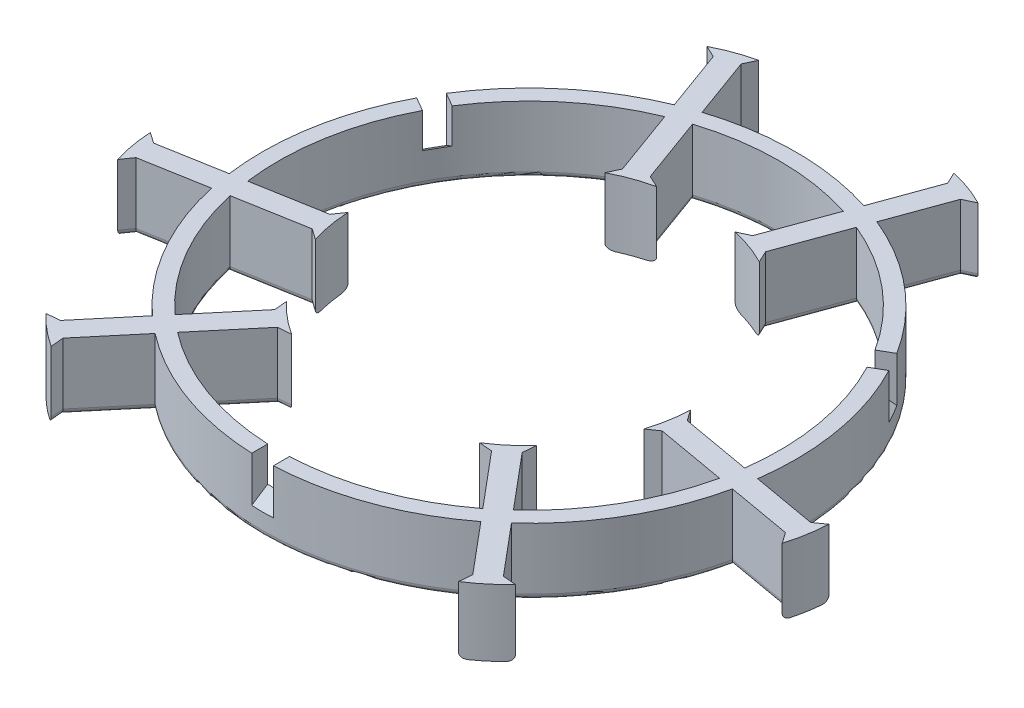
from build123d import *

# Parameters (mm, degrees)
BOSS_EXTRUDE1_DEPTH   = 3.265
BOSS_EXTRUDE1_2_DEPTH = 3.265
BOSS_EXTRUDE1_3_DEPTH = 3.265
BOSS_EXTRUDE2_START   = 3
BOSS_EXTRUDE2_DEPTH   = 3
CUT_EXTRUDE1_START    = -1.02
CUT_EXTRUDE1_DEPTH    = 2.04
CUT_EXTRUDE2_START    = -1.02
CUT_EXTRUDE2_DEPTH    = 2.04
CUT_EXTRUDE3_START    = -1.02
CUT_EXTRUDE3_DEPTH    = 2.04
FILLET1_R             = 0.5


# Read off the part's stored shape, not the designer's step: Cut-Extrude1, Cut-Extrude2, Cut-Extrude3
with BuildPart() as part:
    # Sketch1 → Boss-Extrude1 (new body)
    with BuildSketch(Plane(origin=(0, 0, 0), x_dir=(1, 0, 0), z_dir=(0, 1, 0))):
        with BuildLine():
            Line((-6.724046161570257, 15.491884508116268), (-7.243917375737632, 14.377017091559226))
            ThreePointArc((-7.243917375737632, 14.377017091559226), (-5.5101366147460755, 15.138975927126317), (-3.692205798608258, 15.669734386333252))
            Line((-3.692205798608258, 15.669734386333252), (-4.807073215166055, 16.189605600500883))
            Line((-4.807073215166055, 16.189605600500883), (-7.0816825804111705, 22.43904346959337))
            ThreePointArc((-7.0816825804111705, 22.43904346959337), (-2.991e-14, 23.529999999999998), (7.08168258041111, 22.43904346959339))
            Line((7.08168258041111, 22.43904346959339), (4.807073215165557, 16.189605600501192))
            Line((4.807073215165557, 16.189605600501192), (3.692205798609078, 15.669734386332689))
            ThreePointArc((3.692205798609078, 15.669734386332689), (5.510136614746928, 15.138975927126017), (7.243917375738558, 14.377017091559186))
            Line((7.243917375738558, 14.377017091559186), (6.724046161570118, 15.49188450811891))
            Line((6.724046161570118, 15.49188450811891), (8.998655526814698, 21.74132237720896))
            ThreePointArc((8.998655526814698, 21.74132237720896), (15.124792455922533, 18.02502574659101), (19.848422704126936, 12.637286740368689))
            Line((19.848422704126936, 12.637286740368689), (21.146442856281965, 13.386699024628935))
            ThreePointArc((21.146442856281965, 13.386699024628935), (16.087366901428126, 19.17217730016167), (9.511283720560114, 23.149756764100303))
            Line((9.511283720560114, 23.149756764100303), (11.608093808260845, 28.910695132942674))
            Line((11.608093808260845, 28.910695132942674), (12.722961225975256, 29.43056634765067))
            ThreePointArc((12.722961225975256, 29.43056634765067), (10.988981231010918, 30.191977795013887), (9.171249647149319, 30.723283643037668))
            Line((9.171249647149319, 30.723283643037668), (9.691120861856094, 29.608416225323964))
            Line((9.691120861856094, 29.608416225323964), (7.594310774156528, 23.84747785648474))
            ThreePointArc((7.594310774156528, 23.84747785648474), (-2.07e-14, 25.0275), (-7.594310774156574, 23.847477856484723))
            Line((-7.594310774156574, 23.847477856484723), (-9.691120861856122, 29.608416225323918))
            Line((-9.691120861856122, 29.608416225323918), (-9.171249647149548, 30.723283643037583))
            ThreePointArc((-9.171249647149548, 30.723283643037583), (-10.988981231010609, 30.191977795011873), (-12.72296122597416, 29.430566347646813))
            Line((-12.72296122597416, 29.430566347646813), (-11.608093808260813, 28.910695132939033))
            Line((-11.608093808260813, 28.910695132939033), (-9.511283720561256, 23.14975676409983))
            ThreePointArc((-9.511283720561256, 23.14975676409983), (-16.08736690143116, 19.17217730015912), (-21.14644285628554, 13.386699024623285))
            Line((-21.14644285628554, 13.386699024623285), (-19.848422704130538, 12.63728674036303))
            ThreePointArc((-19.848422704130538, 12.63728674036303), (-15.12479245592557, 18.025025746588454), (-8.998655526815837, 21.741322377208487))
            Line((-8.998655526815837, 21.741322377208487), (-6.724046161570257, 15.491884508116268))
        make_face()
    extrude(amount=BOSS_EXTRUDE1_DEPTH)



with BuildPart() as body_2:
    # Sketch1 → Boss-Extrude1 2 (new body)
    with BuildSketch(Plane(origin=(0, 0, 0), x_dir=(1, 0, 0), z_dir=(0, 1, 0))):
        with BuildLine():
            Line((16.778388617308416, -1.9227474619188947), (16.072820719802163, -0.915092075474559))
            ThreePointArc((16.072820719802163, -0.915092075474559), (15.865806047545636, -2.797569676869933), (15.416490948423451, -4.637323175571752))
            Line((15.416490948423451, -4.637323175571752), (16.424146334867597, -3.931755278064976))
            Line((16.424146334867597, -3.931755278064976), (22.97362297149689, -5.086604718622285))
            ThreePointArc((22.97362297149689, -5.086604718622285), (20.377577751048157, -11.764999999999455), (15.89194039108607, -17.352438750970055))
            Line((15.89194039108607, -17.352438750970055), (11.617073119702077, -12.257850322435555))
            Line((11.617073119702077, -12.257850322435555), (11.724285149814596, -11.032411210761367))
            ThreePointArc((11.724285149814596, -11.032411210761367), (10.355669432799003, -12.341406250256417), (8.82890334406401, -13.461925016084827))
            Line((8.82890334406401, -13.461925016084827), (10.05434245573841, -13.569137046196877))
            Line((10.05434245573841, -13.569137046196877), (14.329209727122183, -18.663725474731653))
            ThreePointArc((14.329209727122183, -18.663725474731653), (8.047733972454916, -22.110967367091718), (1.0200000000042755, -23.507881657010085))
            Line((1.0200000000042755, -23.507881657010085), (1.0200000000042755, -25.0067062255306))
            ThreePointArc((1.0200000000042755, -25.0067062255306), (8.559909137085095, -23.518157066718615), (15.292635588860929, -19.811891706656986))
            Line((15.292635588860929, -19.811891706656986), (19.233349522062255, -24.508251693935826))
            Line((19.233349522062255, -24.508251693935826), (19.12613749183851, -25.733690806881363))
            ThreePointArc((19.12613749183851, -25.733690806881363), (20.652529145470048, -24.612725805270422), (22.021519298969324, -23.304177000397384))
            Line((22.021519298969324, -23.304177000397384), (20.79608018602495, -23.19696497017267))
            Line((20.79608018602495, -23.19696497017267), (16.85536625282483, -18.50060498289538))
            ThreePointArc((16.85536625282483, -18.50060498289538), (21.674450793215346, -12.513749999999444), (24.449677026981057, -5.346872873588295))
            Line((24.449677026981057, -5.346872873588295), (30.487201047881946, -6.411451255148618))
            Line((30.487201047881946, -6.411451255148618), (31.192768946120204, -7.419106642638354))
            ThreePointArc((31.192768946120204, -7.419106642638354), (31.64151037648007, -5.579251989740153), (31.84909871781023, -3.6968755407649807))
            Line((31.84909871781023, -3.6968755407649807), (30.841443330320814, -4.4024434390017975))
            Line((30.841443330320814, -4.4024434390017975), (24.80391930942181, -3.3378650574418454))
            ThreePointArc((24.80391930942181, -3.3378650574418454), (24.647276038512683, 4.345979766561039), (22.166442856282952, 11.6200072009075))
            Line((22.166442856282952, 11.6200072009075), (20.868422704127948, 10.870594916647262))
            ThreePointArc((20.868422704127948, 10.870594916647262), (23.17252642837691, 4.085941620504811), (23.327865253937638, -3.0775969024758494))
            Line((23.327865253937638, -3.0775969024758494), (16.778388617308416, -1.9227474619188947))
        make_face()
    extrude(amount=BOSS_EXTRUDE1_2_DEPTH)


with BuildPart() as body_3:
    # Sketch1 → Boss-Extrude1 3 (new body)
    with BuildSketch(Plane(origin=(0, 0, 0), x_dir=(1, 0, 0), z_dir=(0, 1, 0))):
        with BuildLine():
            Line((-10.054342455737974, -13.569137046197184), (-8.828903344063827, -13.461925016084178))
            ThreePointArc((-8.828903344063827, -13.461925016084178), (-10.355669432799177, -12.341406250256197), (-11.724285149815183, -11.032411210761536))
            Line((-11.724285149815183, -11.032411210761536), (-11.617073119701665, -12.257850322435877))
            Line((-11.617073119701665, -12.257850322435877), (-15.891940391085214, -17.35243875097084))
            ThreePointArc((-15.891940391085214, -17.35243875097084), (-20.37757775104771, -11.765000000000223), (-22.973622971496752, -5.086604718622892))
            Line((-22.973622971496752, -5.086604718622892), (-16.424146334867487, -3.9317552780654426))
            Line((-16.424146334867487, -3.9317552780654426), (-15.416490948422714, -4.63732317557104))
            ThreePointArc((-15.416490948422714, -4.63732317557104), (-15.865806047545515, -2.797569676869464), (-16.072820719802706, -0.915092075474255))
            Line((-16.072820719802706, -0.915092075474255), (-16.77838861730829, -1.92274746191903))
            Line((-16.77838861730829, -1.92274746191903), (-23.327865253937556, -3.077596902476493))
            ThreePointArc((-23.327865253937556, -3.077596902476493), (-23.17252642837756, 4.085941620501193), (-20.86842270413105, 10.870594916641313))
            Line((-20.86842270413105, 10.870594916641313), (-22.16644285628606, 11.620007200901576))
            ThreePointArc((-22.16644285628606, 11.620007200901576), (-24.647276038513326, 4.345979766557433), (-24.803919309421726, -3.3378650574425))
            Line((-24.803919309421726, -3.3378650574425), (-30.841443330322626, -4.402443439002778))
            Line((-30.841443330322626, -4.402443439002778), (-31.84909871781261, -3.696875540765329))
            ThreePointArc((-31.84909871781261, -3.696875540765329), (-31.64151037648127, -5.579251989740306), (-31.192768946120268, -7.419106642638173))
            Line((-31.192768946120268, -7.419106642638173), (-30.48720104788182, -6.411451255149191))
            Line((-30.48720104788182, -6.411451255149191), (-24.449677026980922, -5.346872873588901))
            ThreePointArc((-24.449677026980922, -5.346872873588901), (-21.674450793214902, -12.513750000000215), (-16.855366252823973, -18.500604982896164))
            Line((-16.855366252823973, -18.500604982896164), (-20.796080186025396, -23.196964970174925))
            Line((-20.796080186025396, -23.196964970174925), (-22.021519298970887, -23.30417700039917))
            ThreePointArc((-22.021519298970887, -23.30417700039917), (-20.652529145470872, -24.612725805271324), (-19.126137491838684, -25.73369080688126))
            Line((-19.126137491838684, -25.73369080688126), (-19.233349522061783, -24.508251693936156))
            Line((-19.233349522061783, -24.508251693936156), (-15.29263558886042, -19.811891706657374))
            ThreePointArc((-15.29263558886042, -19.811891706657374), (-8.559909137081489, -23.518157066719926), (-1.0199999999972424, -25.006706225530888))
            Line((-1.0199999999972424, -25.006706225530888), (-1.0199999999972424, -23.50788165701039))
            ThreePointArc((-1.0199999999972424, -23.50788165701039), (-8.047733972451303, -22.110967367093032), (-14.329209727121667, -18.663725474732036))
            Line((-14.329209727121667, -18.663725474732036), (-10.054342455737974, -13.569137046197184))
        make_face()
    extrude(amount=BOSS_EXTRUDE1_3_DEPTH)


with BuildPart() as part_1:
    add(part.part)

    add(body_2.part)  # Boss-Extrude2 merges body 2

    add(body_3.part)  # Boss-Extrude2 merges body 3
    # Sketch2 → Boss-Extrude2 (add)
    with BuildSketch(Plane.XZ.offset(BOSS_EXTRUDE2_START)):
        with BuildLine():
            Line((-9.511283720561254, -23.149756764099834), (-11.608093808260813, -28.910695132939033))
            Line((-11.608093808260813, -28.910695132939033), (-12.72296122597416, -29.430566347646813))
            ThreePointArc((-12.72296122597416, -29.430566347646813), (-10.98898123101061, -30.191977795011873), (-9.171249647149551, -30.723283643037583))
            Line((-9.171249647149551, -30.723283643037583), (-9.691120861856122, -29.608416225323918))
            Line((-9.691120861856122, -29.608416225323918), (-7.594310774156574, -23.847477856484723))
            ThreePointArc((-7.594310774156574, -23.847477856484723), (-2.07e-14, -25.027499999999996), (7.59431077415653, -23.84747785648474))
            Line((7.59431077415653, -23.84747785648474), (9.691120861856094, -29.608416225323964))
            Line((9.691120861856094, -29.608416225323964), (9.171249647149319, -30.723283643037668))
            ThreePointArc((9.171249647149319, -30.723283643037668), (10.988981231010918, -30.191977795013887), (12.722961225975256, -29.43056634765067))
            Line((12.722961225975256, -29.43056634765067), (11.608093808260845, -28.910695132942674))
            Line((11.608093808260845, -28.910695132942674), (9.511283720560114, -23.149756764100303))
            ThreePointArc((9.511283720560114, -23.149756764100303), (16.08736690142813, -19.17217730016167), (21.146442856281965, -13.386699024628932))
            ThreePointArc((21.146442856281965, -13.386699024628932), (21.67445079321339, -12.513750000002842), (22.166442856282952, -11.6200072009075))
            ThreePointArc((22.166442856282952, -11.6200072009075), (24.647276038512686, -4.345979766561041), (24.803919309421815, 3.3378650574418436))
            Line((24.803919309421815, 3.3378650574418436), (30.841443330320814, 4.4024434390017975))
            Line((30.841443330320814, 4.4024434390017975), (31.84909871781023, 3.6968755407649807))
            ThreePointArc((31.84909871781023, 3.6968755407649807), (31.64151037648007, 5.579251989740151), (31.192768946120207, 7.4191066426383525))
            Line((31.192768946120207, 7.4191066426383525), (30.487201047881946, 6.411451255148618))
            Line((30.487201047881946, 6.411451255148618), (24.449677026981057, 5.346872873588295))
            ThreePointArc((24.449677026981057, 5.346872873588295), (21.67445079321535, 12.513749999999446), (16.85536625282483, 18.50060498289538))
            Line((16.85536625282483, 18.50060498289538), (20.79608018602495, 23.19696497017267))
            Line((20.79608018602495, 23.19696497017267), (22.021519298969324, 23.304177000397384))
            ThreePointArc((22.021519298969324, 23.304177000397384), (20.652529145470048, 24.612725805270422), (19.126137491838495, 25.73369080688134))
            Line((19.126137491838495, 25.73369080688134), (19.233349522062255, 24.508251693935826))
            Line((19.233349522062255, 24.508251693935826), (15.292635588860929, 19.811891706656986))
            ThreePointArc((15.292635588860929, 19.811891706656986), (8.559909137085095, 23.518157066718615), (1.0200000000042755, 25.0067062255306))
            ThreePointArc((1.0200000000042755, 25.0067062255306), (3.51925e-12, 25.027499999999993), (-1.0199999999972424, 25.006706225530888))
            ThreePointArc((-1.0199999999972424, 25.006706225530888), (-8.5599091370815, 23.518157066719926), (-15.292635588860433, 19.81189170665737))
            Line((-15.292635588860433, 19.81189170665737), (-19.233349522061783, 24.508251693936156))
            Line((-19.233349522061783, 24.508251693936156), (-19.126137491838684, 25.73369080688126))
            ThreePointArc((-19.126137491838684, 25.73369080688126), (-20.652529145470865, 24.61272580527133), (-22.021519298970887, 23.304177000399175))
            Line((-22.021519298970887, 23.304177000399175), (-20.796080186025396, 23.196964970174925))
            Line((-20.796080186025396, 23.196964970174925), (-16.855366252823973, 18.500604982896164))
            ThreePointArc((-16.855366252823973, 18.500604982896164), (-21.674450793214906, 12.513750000000217), (-24.44967702698093, 5.346872873588897))
            Line((-24.44967702698093, 5.346872873588897), (-30.48720104788182, 6.411451255149191))
            Line((-30.48720104788182, 6.411451255149191), (-31.192768946120268, 7.419106642638173))
            ThreePointArc((-31.192768946120268, 7.419106642638173), (-31.64151037648127, 5.579251989740312), (-31.84909871781261, 3.6968755407653346))
            Line((-31.84909871781261, 3.6968755407653346), (-30.841443330322626, 4.402443439002778))
            Line((-30.841443330322626, 4.402443439002778), (-24.803919309421726, 3.3378650574425))
            ThreePointArc((-24.803919309421726, 3.3378650574425), (-24.647276038513326, -4.345979766557416), (-22.166442856286057, -11.620007200901577))
            ThreePointArc((-22.166442856286057, -11.620007200901577), (-21.674450793216735, -12.51374999999705), (-21.14644285628554, -13.386699024623285))
            ThreePointArc((-21.14644285628554, -13.386699024623285), (-16.087366901431164, -19.172177300159124), (-9.511283720561254, -23.149756764099834))
        make_face()
        with BuildLine():
            Line((-7.0816825804111705, -22.43904346959337), (-4.807073215166055, -16.189605600500883))
            Line((-4.807073215166055, -16.189605600500883), (-3.692205798608258, -15.669734386333252))
            ThreePointArc((-3.692205798608258, -15.669734386333252), (-5.510136614746073, -15.138975927126321), (-7.243917375737628, -14.377017091559228))
            Line((-7.243917375737628, -14.377017091559228), (-6.724046161570257, -15.491884508116268))
            Line((-6.724046161570257, -15.491884508116268), (-8.998655526815837, -21.741322377208487))
            ThreePointArc((-8.998655526815837, -21.741322377208487), (-15.124792455925574, -18.025025746588454), (-19.848422704130535, -12.637286740363033))
            ThreePointArc((-19.848422704130535, -12.637286740363033), (-20.377577751049543, -11.764999999997048), (-20.86842270413105, -10.870594916641313))
            ThreePointArc((-20.86842270413105, -10.870594916641313), (-23.17252642837756, -4.085941620501187), (-23.32786525393756, 3.0775969024764853))
            Line((-23.32786525393756, 3.0775969024764853), (-16.77838861730829, 1.92274746191903))
            Line((-16.77838861730829, 1.92274746191903), (-16.072820719802706, 0.915092075474255))
            ThreePointArc((-16.072820719802706, 0.915092075474255), (-15.865806047545522, 2.797569676869458), (-15.416490948422712, 4.637323175571034))
            Line((-15.416490948422712, 4.637323175571034), (-16.424146334867487, 3.9317552780654426))
            Line((-16.424146334867487, 3.9317552780654426), (-22.973622971496752, 5.086604718622892))
            ThreePointArc((-22.973622971496752, 5.086604718622892), (-20.377577751047713, 11.765000000000224), (-15.89194039108521, 17.352438750970844))
            Line((-15.89194039108521, 17.352438750970844), (-11.617073119701665, 12.257850322435877))
            Line((-11.617073119701665, 12.257850322435877), (-11.724285149815183, 11.032411210761536))
            ThreePointArc((-11.724285149815183, 11.032411210761536), (-10.355669432799182, 12.341406250256203), (-8.828903344063828, 13.46192501608417))
            Line((-8.828903344063828, 13.46192501608417), (-10.054342455737974, 13.569137046197184))
            Line((-10.054342455737974, 13.569137046197184), (-14.329209727121667, 18.663725474732036))
            ThreePointArc((-14.329209727121667, 18.663725474732036), (-8.047733972451304, 22.110967367093036), (-1.0199999999972424, 23.50788165701039))
            ThreePointArc((-1.0199999999972424, 23.50788165701039), (3.5229e-12, 23.529999999999998), (1.0200000000042755, 23.507881657010085))
            ThreePointArc((1.0200000000042755, 23.507881657010085), (8.047733972454918, 22.11096736709172), (14.329209727122182, 18.66372547473165))
            Line((14.329209727122182, 18.66372547473165), (10.05434245573841, 13.569137046196877))
            Line((10.05434245573841, 13.569137046196877), (8.82890334406401, 13.461925016084827))
            ThreePointArc((8.82890334406401, 13.461925016084827), (10.355669432799003, 12.341406250256417), (11.724285149814596, 11.032411210761365))
            Line((11.724285149814596, 11.032411210761365), (11.617073119702077, 12.257850322435555))
            Line((11.617073119702077, 12.257850322435555), (15.89194039108607, 17.352438750970055))
            ThreePointArc((15.89194039108607, 17.352438750970055), (20.377577751048157, 11.764999999999455), (22.97362297149689, 5.086604718622286))
            Line((22.97362297149689, 5.086604718622286), (16.424146334867597, 3.931755278064976))
            Line((16.424146334867597, 3.931755278064976), (15.416490948423451, 4.637323175571752))
            ThreePointArc((15.416490948423451, 4.637323175571752), (15.865806047545632, 2.7975696768699327), (16.072820719802163, 0.9150920754745584))
            Line((16.072820719802163, 0.9150920754745584), (16.778388617308416, 1.9227474619188947))
            Line((16.778388617308416, 1.9227474619188947), (23.327865253937638, 3.0775969024758494))
            ThreePointArc((23.327865253937638, 3.0775969024758494), (23.17252642837691, -4.085941620504815), (20.86842270412794, -10.870594916647264))
            ThreePointArc((20.86842270412794, -10.870594916647264), (20.377577751046186, -11.765000000002859), (19.848422704126936, -12.637286740368689))
            ThreePointArc((19.848422704126936, -12.637286740368689), (15.12479245592253, -18.025025746591005), (8.998655526814698, -21.74132237720896))
            Line((8.998655526814698, -21.74132237720896), (6.724046161570118, -15.49188450811891))
            Line((6.724046161570118, -15.49188450811891), (7.243917375738558, -14.377017091559186))
            ThreePointArc((7.243917375738558, -14.377017091559186), (5.510136614746928, -15.138975927126015), (3.6922057986090793, -15.669734386332689))
            Line((3.6922057986090793, -15.669734386332689), (4.807073215165557, -16.189605600501192))
            Line((4.807073215165557, -16.189605600501192), (7.08168258041111, -22.43904346959339))
            ThreePointArc((7.08168258041111, -22.43904346959339), (-2.991e-14, -23.529999999999998), (-7.0816825804111705, -22.43904346959337))
        make_face(mode=Mode.SUBTRACT)
    extrude(amount=-BOSS_EXTRUDE2_DEPTH)

    # Cut-Extrude1 outline → Cut-Extrude1 (cut)
    with BuildSketch(Plane.YZ.offset(CUT_EXTRUDE1_START)):
        Polygon((-0.989689724, 25.0275), (0, 23.507881657), (0, 27), (-2, 27), (-2, 26.578780154), align=None)
    extrude(amount=CUT_EXTRUDE1_DEPTH, mode=Mode.SUBTRACT)

    # Cut-Extrude2 outline → Cut-Extrude2 (cut)
    with BuildSketch(Plane(origin=(0, 0, 0), x_dir=(0.8660254037844428, 0, -0.49999999999999295), z_dir=(0.4999999999999929, 0, 0.8660254037844428)).offset(CUT_EXTRUDE2_START)):
        Polygon((23.507881657, 0), (25.0275, -0.989689724), (26.578780154, -2), (27, -2), (27, 0), align=None)
    extrude(amount=CUT_EXTRUDE2_DEPTH, mode=Mode.SUBTRACT)

    # Cut-Extrude3 outline → Cut-Extrude3 (cut)
    with BuildSketch(Plane(origin=(0, 0, 0), x_dir=(0.8660254037844362, 0, 0.5000000000000042), z_dir=(0.5000000000000042, 0, -0.8660254037844363)).offset(CUT_EXTRUDE3_START)):
        Polygon((-23.507881657, 0), (-25.0275, 0.989689724), (-26.578780154, 2), (-27, 2), (-27, 0), align=None)
    extrude(amount=CUT_EXTRUDE3_DEPTH, mode=Mode.SUBTRACT)

    # Fillet1
    fillet1_edges = [part_1.edges().sort_by_distance(p)[0] for p in [
        (-21.67445079321503, -3, -12.51375),
        (-10.559688764411034, -3, -26.030225948519433),
        (-12.165527517117486, -3, -29.17063074029292),
        (-9.431185254502836, -3, -30.16584993418075),
        (-8.642715818006348, -3, -26.72794704090432),
        (-2.398e-14, -3, -25.027499999999996),
        (8.642715818006312, -3, -26.727947040904354),
        (9.431185254502706, -3, -30.165849934180816),
        (12.16552751711805, -3, -29.170630740296673),
        (10.55968876441048, -3, -26.03022594852149),
        (21.67445079321456, -3, -12.513750000000817),
        (27.822681319871315, -3, 3.8701542482218203),
        (31.34527102406552, -3, 4.049659489883389),
        (30.83998499700108, -3, 6.915278948893485),
        (27.4684390374315, -3, 5.879162064368456),
        (21.674450793215343, -3, 12.513749999999444),
        (18.825723219424887, -3, 20.848784976534024),
        (21.408799742497138, -3, 23.250570985285027),
        (19.179743506950373, -3, 25.120971250408584),
        (17.262992555461594, -3, 22.160071700296406),
        (3.1797e-13, -3, 25.027499999999996),
        (-17.262992555461107, -3, 22.16007170029676),
        (-19.17974350695023, -3, 25.120971250408708),
        (-21.40879974249814, -3, 23.250570985287048),
        (-18.825723219424685, -3, 20.848784976535544),
        (-21.674450793214902, -3, 12.513750000000217),
        (-27.468439037431374, -3, 5.879162064369044),
        (-30.839984997001043, -3, 6.9152789488936826),
        (-31.345271024067618, -3, 4.049659489884056),
        (-27.822681319872174, -3, 3.870154248222639),
        (-3.442e-14, -3, -23.529999999999994),
        (5.944377897788334, -3, -19.31432453504729),
        (4.249639506887318, -3, -15.92966999341694),
        (6.983981768654338, -3, -14.934450799839048),
        (7.861350844192408, -3, -18.616603442663934),
        (20.37757775104737, -3, -11.76500000000081),
        (20.053126935623027, -3, 2.500172182197372),
        (16.425604668555287, -3, 1.4189197686967265),
        (15.920318641645524, -3, 4.284539226818364),
        (19.698884653182244, -3, 4.5091799983436305),
        (20.377577751048165, -3, 11.764999999999457),
        (13.754506755394074, -3, 14.805144536702805),
        (11.670679134758338, -3, 11.64513076659846),
        (9.44162289990121, -3, 13.515531031140853),
        (12.191776091430295, -3, 16.116431260464264),
        (3.153e-13, -3, 23.53000000000001),
        (-12.19177609142982, -3, 16.11643126046461),
        (-9.441622899900901, -3, 13.515531031140677),
        (-11.670679134758423, -3, 11.645130766598706),
        (-13.754506755393438, -3, 14.80514453670336),
        (-20.37757775104771, -3, 11.765000000000228),
        (-19.69888465318212, -3, 4.509179998344168),
        (-15.9203186416451, -3, 4.284539226818238),
        (-16.4256046685555, -3, 1.4189197686966424),
        (-20.053126935622927, -3, 2.5001721821977574),
        (-20.377577751047845, -3, -11.765000000000002),
        (-7.861350844193047, -3, -18.616603442662377),
        (-6.983981768653942, -3, -14.934450799837748),
        (-4.249639506887156, -3, -15.929669993417068),
        (-5.944377897788613, -3, -19.314324535047128),
    ]]
    fillet(fillet1_edges, radius=FILLET1_R)


solid = part_1.part
